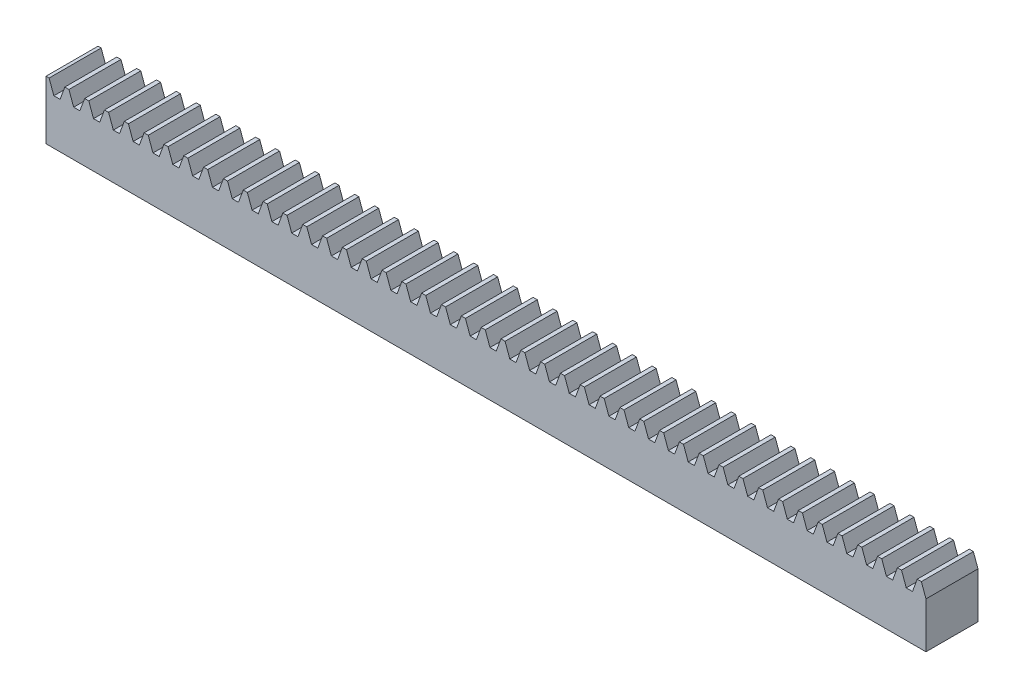
from build123d import *

# Parameters (mm, degrees)
SKETCH1_W           = 67.650000082
SKETCH1_H           = 4
BOSS_EXTRUDE1_DEPTH = 4.5
CUT_EXTRUDE1_DEPTH  = 68.917394761


with BuildPart() as part:
    # Sketch1 → Boss-Extrude1 (new body)
    with BuildSketch(Plane(origin=(0, 0, 0), x_dir=(1, 0, 0), z_dir=(0, 1, 0))):
        with Locations((33.825000041, 2)):
            Rectangle(SKETCH1_W, SKETCH1_H)
    extrude(amount=BOSS_EXTRUDE1_DEPTH)

    # Sketch2 → Cut-Extrude1 (cut, through all)
    with BuildSketch(Plane.XY):
        Polygon((0.239013956, 4.5), (0.60298419, 3.5), (0.841998146, 3.5), (1.081012101, 3.5), (1.444982335, 4.5), align=None)
        Polygon((1.763013956, 4.5), (2.12698419, 3.5), (2.365998146, 3.5), (2.605012101, 3.5), (2.968982335, 4.5), align=None)
        Polygon((3.287013956, 4.5), (3.65098419, 3.5), (3.889998146, 3.5), (4.129012101, 3.5), (4.492982335, 4.5), align=None)
        Polygon((4.811013956, 4.5), (5.17498419, 3.5), (5.413998146, 3.5), (5.653012101, 3.5), (6.016982335, 4.5), align=None)
        Polygon((6.335013956, 4.5), (6.69898419, 3.5), (6.937998146, 3.5), (7.177012101, 3.5), (7.540982335, 4.5), align=None)
        Polygon((7.859013956, 4.5), (8.22298419, 3.5), (8.461998146, 3.5), (8.701012101, 3.5), (9.064982335, 4.5), align=None)
        Polygon((9.383013956, 4.5), (9.74698419, 3.5), (9.985998146, 3.5), (10.225012101, 3.5), (10.588982335, 4.5), align=None)
        Polygon((10.907013956, 4.5), (11.27098419, 3.5), (11.509998146, 3.5), (11.749012101, 3.5), (12.112982335, 4.5), align=None)
        Polygon((12.431013956, 4.5), (12.79498419, 3.5), (13.033998146, 3.5), (13.273012101, 3.5), (13.636982335, 4.5), align=None)
        Polygon((13.955013956, 4.5), (14.31898419, 3.5), (14.557998146, 3.5), (14.797012101, 3.5), (15.160982335, 4.5), align=None)
        Polygon((15.479013956, 4.5), (15.84298419, 3.5), (16.081998146, 3.5), (16.321012101, 3.5), (16.684982335, 4.5), align=None)
        Polygon((17.003013956, 4.5), (17.36698419, 3.5), (17.605998146, 3.5), (17.845012101, 3.5), (18.208982335, 4.5), align=None)
        Polygon((18.527013956, 4.5), (18.89098419, 3.5), (19.129998146, 3.5), (19.369012101, 3.5), (19.732982335, 4.5), align=None)
        Polygon((20.051013956, 4.5), (20.41498419, 3.5), (20.653998146, 3.5), (20.893012101, 3.5), (21.256982335, 4.5), align=None)
        Polygon((21.575013956, 4.5), (21.93898419, 3.5), (22.177998146, 3.5), (22.417012101, 3.5), (22.780982335, 4.5), align=None)
        Polygon((23.099013956, 4.5), (23.46298419, 3.5), (23.701998146, 3.5), (23.941012101, 3.5), (24.304982335, 4.5), align=None)
        Polygon((24.623013956, 4.5), (24.98698419, 3.5), (25.225998146, 3.5), (25.465012101, 3.5), (25.828982335, 4.5), align=None)
        Polygon((26.147013956, 4.5), (26.51098419, 3.5), (26.749998146, 3.5), (26.989012101, 3.5), (27.352982335, 4.5), align=None)
        Polygon((27.671013956, 4.5), (28.03498419, 3.5), (28.273998146, 3.5), (28.513012101, 3.5), (28.876982335, 4.5), align=None)
        Polygon((29.195013956, 4.5), (29.55898419, 3.5), (29.797998146, 3.5), (30.037012101, 3.5), (30.400982335, 4.5), align=None)
        Polygon((30.719013956, 4.5), (31.08298419, 3.5), (31.321998146, 3.5), (31.561012101, 3.5), (31.924982335, 4.5), align=None)
        Polygon((32.243013956, 4.5), (32.60698419, 3.5), (32.845998146, 3.5), (33.085012101, 3.5), (33.448982335, 4.5), align=None)
        Polygon((33.767013956, 4.5), (34.13098419, 3.5), (34.369998146, 3.5), (34.609012101, 3.5), (34.972982335, 4.5), align=None)
        Polygon((35.291013956, 4.5), (35.65498419, 3.5), (35.893998146, 3.5), (36.133012101, 3.5), (36.496982335, 4.5), align=None)
        Polygon((36.815013956, 4.5), (37.17898419, 3.5), (37.417998146, 3.5), (37.657012101, 3.5), (38.020982335, 4.5), align=None)
        Polygon((38.339013956, 4.5), (38.70298419, 3.5), (38.941998146, 3.5), (39.181012101, 3.5), (39.544982335, 4.5), align=None)
        Polygon((39.863013956, 4.5), (40.22698419, 3.5), (40.465998146, 3.5), (40.705012101, 3.5), (41.068982335, 4.5), align=None)
        Polygon((41.387013956, 4.5), (41.75098419, 3.5), (41.989998146, 3.5), (42.229012101, 3.5), (42.592982335, 4.5), align=None)
        Polygon((42.911013956, 4.5), (43.27498419, 3.5), (43.513998146, 3.5), (43.753012101, 3.5), (44.116982335, 4.5), align=None)
        Polygon((44.435013956, 4.5), (44.79898419, 3.5), (45.037998146, 3.5), (45.277012101, 3.5), (45.640982335, 4.5), align=None)
        Polygon((45.959013956, 4.5), (46.32298419, 3.5), (46.561998146, 3.5), (46.801012101, 3.5), (47.164982335, 4.5), align=None)
        Polygon((47.483013956, 4.5), (47.84698419, 3.5), (48.085998146, 3.5), (48.325012101, 3.5), (48.688982335, 4.5), align=None)
        Polygon((49.007013956, 4.5), (49.37098419, 3.5), (49.609998146, 3.5), (49.849012101, 3.5), (50.212982335, 4.5), align=None)
        Polygon((50.531013956, 4.5), (50.89498419, 3.5), (51.133998146, 3.5), (51.373012101, 3.5), (51.736982335, 4.5), align=None)
        Polygon((52.055013956, 4.5), (52.41898419, 3.5), (52.657998146, 3.5), (52.897012101, 3.5), (53.260982335, 4.5), align=None)
        Polygon((53.579013956, 4.5), (53.94298419, 3.5), (54.181998146, 3.5), (54.421012101, 3.5), (54.784982335, 4.5), align=None)
        Polygon((55.103013956, 4.5), (55.46698419, 3.5), (55.705998146, 3.5), (55.945012101, 3.5), (56.308982335, 4.5), align=None)
        Polygon((56.627013956, 4.5), (56.99098419, 3.5), (57.229998146, 3.5), (57.469012101, 3.5), (57.832982335, 4.5), align=None)
        Polygon((58.151013956, 4.5), (58.51498419, 3.5), (58.753998146, 3.5), (58.993012101, 3.5), (59.356982335, 4.5), align=None)
        Polygon((59.675013956, 4.5), (60.03898419, 3.5), (60.277998146, 3.5), (60.517012101, 3.5), (60.880982335, 4.5), align=None)
        Polygon((61.199013956, 4.5), (61.56298419, 3.5), (61.801998146, 3.5), (62.041012101, 3.5), (62.404982335, 4.5), align=None)
        Polygon((62.723013956, 4.5), (63.08698419, 3.5), (63.325998146, 3.5), (63.565012101, 3.5), (63.928982335, 4.5), align=None)
        Polygon((64.247013956, 4.5), (64.61098419, 3.5), (64.849998146, 3.5), (65.089012101, 3.5), (65.452982335, 4.5), align=None)
        Polygon((65.771013956, 4.5), (66.13498419, 3.5), (66.373998146, 3.5), (66.613012101, 3.5), (66.976982335, 4.5), align=None)
        Polygon((67.295013956, 4.5), (67.65898419, 3.5), (67.897998146, 3.5), (68.137012101, 3.5), (68.500982335, 4.5), align=None)
        Polygon((68.819013956, 4.5), (69.18298419, 3.5), (69.421998146, 3.5), (69.661012101, 3.5), (70.024982335, 4.5), align=None)
        Polygon((70.343013956, 4.5), (70.70698419, 3.5), (70.945998146, 3.5), (71.185012101, 3.5), (71.548982335, 4.5), align=None)
        Polygon((71.867013956, 4.5), (72.23098419, 3.5), (72.469998146, 3.5), (72.709012101, 3.5), (73.072982335, 4.5), align=None)
        Polygon((73.391013956, 4.5), (73.75498419, 3.5), (73.993998146, 3.5), (74.233012101, 3.5), (74.596982335, 4.5), align=None)
        Polygon((74.915013956, 4.5), (75.27898419, 3.5), (75.517998146, 3.5), (75.757012101, 3.5), (76.120982335, 4.5), align=None)
        Polygon((76.439013956, 4.5), (76.80298419, 3.5), (77.041998146, 3.5), (77.281012101, 3.5), (77.644982335, 4.5), align=None)
        Polygon((77.963013956, 4.5), (78.32698419, 3.5), (78.565998146, 3.5), (78.805012101, 3.5), (79.168982335, 4.5), align=None)
        Polygon((79.487013956, 4.5), (79.85098419, 3.5), (80.089998146, 3.5), (80.329012101, 3.5), (80.692982335, 4.5), align=None)
        Polygon((81.011013956, 4.5), (81.37498419, 3.5), (81.613998146, 3.5), (81.853012101, 3.5), (82.216982335, 4.5), align=None)
        Polygon((82.535013956, 4.5), (82.89898419, 3.5), (83.137998146, 3.5), (83.377012101, 3.5), (83.740982335, 4.5), align=None)
        Polygon((84.059013956, 4.5), (84.42298419, 3.5), (84.661998146, 3.5), (84.901012101, 3.5), (85.264982335, 4.5), align=None)
        Polygon((85.583013956, 4.5), (85.94698419, 3.5), (86.185998146, 3.5), (86.425012101, 3.5), (86.788982335, 4.5), align=None)
        Polygon((87.107013956, 4.5), (87.47098419, 3.5), (87.709998146, 3.5), (87.949012101, 3.5), (88.312982335, 4.5), align=None)
        Polygon((88.631013956, 4.5), (88.99498419, 3.5), (89.233998146, 3.5), (89.473012101, 3.5), (89.836982335, 4.5), align=None)
        Polygon((90.155013956, 4.5), (90.51898419, 3.5), (90.757998146, 3.5), (90.997012101, 3.5), (91.360982335, 4.5), align=None)
        Polygon((91.679013956, 4.5), (92.04298419, 3.5), (92.281998146, 3.5), (92.521012101, 3.5), (92.884982335, 4.5), align=None)
        Polygon((93.203013956, 4.5), (93.56698419, 3.5), (93.805998146, 3.5), (94.045012101, 3.5), (94.408982335, 4.5), align=None)
        Polygon((94.727013956, 4.5), (95.09098419, 3.5), (95.329998146, 3.5), (95.569012101, 3.5), (95.932982335, 4.5), align=None)
        Polygon((96.251013956, 4.5), (96.61498419, 3.5), (96.853998146, 3.5), (97.093012101, 3.5), (97.456982335, 4.5), align=None)
        Polygon((97.775013956, 4.5), (98.13898419, 3.5), (98.377998146, 3.5), (98.617012101, 3.5), (98.980982335, 4.5), align=None)
        Polygon((99.299013956, 4.5), (99.66298419, 3.5), (99.901998146, 3.5), (100.141012101, 3.5), (100.504982335, 4.5), align=None)
        Polygon((100.823013956, 4.5), (101.18698419, 3.5), (101.425998146, 3.5), (101.665012101, 3.5), (102.028982335, 4.5), align=None)
        Polygon((102.347013956, 4.5), (102.71098419, 3.5), (102.949998146, 3.5), (103.189012101, 3.5), (103.552982335, 4.5), align=None)
        Polygon((103.871013956, 4.5), (104.23498419, 3.5), (104.473998146, 3.5), (104.713012101, 3.5), (105.076982335, 4.5), align=None)
        Polygon((105.395013956, 4.5), (105.75898419, 3.5), (105.997998146, 3.5), (106.237012101, 3.5), (106.600982335, 4.5), align=None)
        Polygon((106.919013956, 4.5), (107.28298419, 3.5), (107.521998146, 3.5), (107.761012101, 3.5), (108.124982335, 4.5), align=None)
        Polygon((108.443013956, 4.5), (108.80698419, 3.5), (109.045998146, 3.5), (109.285012101, 3.5), (109.648982335, 4.5), align=None)
        Polygon((109.967013956, 4.5), (110.33098419, 3.5), (110.569998146, 3.5), (110.809012101, 3.5), (111.172982335, 4.5), align=None)
        Polygon((111.491013956, 4.5), (111.85498419, 3.5), (112.093998146, 3.5), (112.333012101, 3.5), (112.696982335, 4.5), align=None)
        Polygon((113.015013956, 4.5), (113.37898419, 3.5), (113.617998146, 3.5), (113.857012101, 3.5), (114.220982335, 4.5), align=None)
        Polygon((114.539013956, 4.5), (114.90298419, 3.5), (115.141998146, 3.5), (115.381012101, 3.5), (115.744982335, 4.5), align=None)
        Polygon((116.063013956, 4.5), (116.42698419, 3.5), (116.665998146, 3.5), (116.905012101, 3.5), (117.268982335, 4.5), align=None)
        Polygon((117.587013956, 4.5), (117.95098419, 3.5), (118.189998146, 3.5), (118.429012101, 3.5), (118.792982335, 4.5), align=None)
        Polygon((119.111013956, 4.5), (119.47498419, 3.5), (119.713998146, 3.5), (119.953012101, 3.5), (120.316982335, 4.5), align=None)
        Polygon((120.635013956, 4.5), (120.99898419, 3.5), (121.237998146, 3.5), (121.477012101, 3.5), (121.840982335, 4.5), align=None)
        Polygon((122.159013956, 4.5), (122.52298419, 3.5), (122.761998146, 3.5), (123.001012101, 3.5), (123.364982335, 4.5), align=None)
        Polygon((123.683013956, 4.5), (124.04698419, 3.5), (124.285998146, 3.5), (124.525012101, 3.5), (124.888982335, 4.5), align=None)
        Polygon((125.207013956, 4.5), (125.57098419, 3.5), (125.809998146, 3.5), (126.049012101, 3.5), (126.412982335, 4.5), align=None)
        Polygon((126.731013956, 4.5), (127.09498419, 3.5), (127.333998146, 3.5), (127.573012101, 3.5), (127.936982335, 4.5), align=None)
        Polygon((128.255013956, 4.5), (128.61898419, 3.5), (128.857998146, 3.5), (129.097012101, 3.5), (129.460982335, 4.5), align=None)
        Polygon((129.779013956, 4.5), (130.14298419, 3.5), (130.381998146, 3.5), (130.621012101, 3.5), (130.984982335, 4.5), align=None)
        Polygon((131.303013956, 4.5), (131.66698419, 3.5), (131.905998146, 3.5), (132.145012101, 3.5), (132.508982335, 4.5), align=None)
        Polygon((132.827013956, 4.5), (133.19098419, 3.5), (133.429998146, 3.5), (133.669012101, 3.5), (134.032982335, 4.5), align=None)
        Polygon((134.351013956, 4.5), (134.71498419, 3.5), (134.953998146, 3.5), (135.193012101, 3.5), (135.556982335, 4.5), align=None)
        Polygon((135.875013956, 4.5), (136.23898419, 3.5), (136.477998146, 3.5), (136.717012101, 3.5), (137.080982335, 4.5), align=None)
        Polygon((137.399013956, 4.5), (137.76298419, 3.5), (138.001998146, 3.5), (138.241012101, 3.5), (138.604982335, 4.5), align=None)
        Polygon((138.923013956, 4.5), (139.28698419, 3.5), (139.525998146, 3.5), (139.765012101, 3.5), (140.128982335, 4.5), align=None)
        Polygon((140.447013956, 4.5), (140.81098419, 3.5), (141.049998146, 3.5), (141.289012101, 3.5), (141.652982335, 4.5), align=None)
        Polygon((141.971013956, 4.5), (142.33498419, 3.5), (142.573998146, 3.5), (142.813012101, 3.5), (143.176982335, 4.5), align=None)
        Polygon((143.495013956, 4.5), (143.85898419, 3.5), (144.097998146, 3.5), (144.337012101, 3.5), (144.700982335, 4.5), align=None)
        Polygon((145.019013956, 4.5), (145.38298419, 3.5), (145.621998146, 3.5), (145.861012101, 3.5), (146.224982335, 4.5), align=None)
        Polygon((146.543013956, 4.5), (146.90698419, 3.5), (147.145998146, 3.5), (147.385012101, 3.5), (147.748982335, 4.5), align=None)
        Polygon((148.067013956, 4.5), (148.43098419, 3.5), (148.669998146, 3.5), (148.909012101, 3.5), (149.272982335, 4.5), align=None)
        Polygon((149.591013956, 4.5), (149.95498419, 3.5), (150.193998146, 3.5), (150.433012101, 3.5), (150.796982335, 4.5), align=None)
        Polygon((151.115013956, 4.5), (151.47898419, 3.5), (151.717998146, 3.5), (151.957012101, 3.5), (152.320982335, 4.5), align=None)
        Polygon((152.639013956, 4.5), (153.00298419, 3.5), (153.241998146, 3.5), (153.481012101, 3.5), (153.844982335, 4.5), align=None)
        Polygon((154.163013956, 4.5), (154.52698419, 3.5), (154.765998146, 3.5), (155.005012101, 3.5), (155.368982335, 4.5), align=None)
        Polygon((155.687013956, 4.5), (156.05098419, 3.5), (156.289998146, 3.5), (156.529012101, 3.5), (156.892982335, 4.5), align=None)
        Polygon((157.211013956, 4.5), (157.57498419, 3.5), (157.813998146, 3.5), (158.053012101, 3.5), (158.416982335, 4.5), align=None)
        Polygon((158.735013956, 4.5), (159.09898419, 3.5), (159.337998146, 3.5), (159.577012101, 3.5), (159.940982335, 4.5), align=None)
        Polygon((160.259013956, 4.5), (160.62298419, 3.5), (160.861998146, 3.5), (161.101012101, 3.5), (161.464982335, 4.5), align=None)
        Polygon((161.783013956, 4.5), (162.14698419, 3.5), (162.385998146, 3.5), (162.625012101, 3.5), (162.988982335, 4.5), align=None)
        Polygon((163.307013956, 4.5), (163.67098419, 3.5), (163.909998146, 3.5), (164.149012101, 3.5), (164.512982335, 4.5), align=None)
        Polygon((164.831013956, 4.5), (165.19498419, 3.5), (165.433998146, 3.5), (165.673012101, 3.5), (166.036982335, 4.5), align=None)
        Polygon((166.355013956, 4.5), (166.71898419, 3.5), (166.957998146, 3.5), (167.197012101, 3.5), (167.560982335, 4.5), align=None)
        Polygon((167.879013956, 4.5), (168.24298419, 3.5), (168.481998146, 3.5), (168.721012101, 3.5), (169.084982335, 4.5), align=None)
        Polygon((169.403013956, 4.5), (169.76698419, 3.5), (170.005998146, 3.5), (170.245012101, 3.5), (170.608982335, 4.5), align=None)
        Polygon((170.927013956, 4.5), (171.29098419, 3.5), (171.529998146, 3.5), (171.769012101, 3.5), (172.132982335, 4.5), align=None)
        Polygon((172.451013956, 4.5), (172.81498419, 3.5), (173.053998146, 3.5), (173.293012101, 3.5), (173.656982335, 4.5), align=None)
        Polygon((173.975013956, 4.5), (174.33898419, 3.5), (174.577998146, 3.5), (174.817012101, 3.5), (175.180982335, 4.5), align=None)
        Polygon((175.499013956, 4.5), (175.86298419, 3.5), (176.101998146, 3.5), (176.341012101, 3.5), (176.704982335, 4.5), align=None)
        Polygon((177.023013956, 4.5), (177.38698419, 3.5), (177.625998146, 3.5), (177.865012101, 3.5), (178.228982335, 4.5), align=None)
        Polygon((178.547013956, 4.5), (178.91098419, 3.5), (179.149998146, 3.5), (179.389012101, 3.5), (179.752982335, 4.5), align=None)
        Polygon((180.071013956, 4.5), (180.43498419, 3.5), (180.673998146, 3.5), (180.913012101, 3.5), (181.276982335, 4.5), align=None)
        Polygon((181.595013956, 4.5), (181.95898419, 3.5), (182.197998146, 3.5), (182.437012101, 3.5), (182.800982335, 4.5), align=None)
        Polygon((183.119013956, 4.5), (183.48298419, 3.5), (183.721998146, 3.5), (183.961012101, 3.5), (184.324982335, 4.5), align=None)
        Polygon((184.643013956, 4.5), (185.00698419, 3.5), (185.245998146, 3.5), (185.485012101, 3.5), (185.848982335, 4.5), align=None)
        Polygon((186.167013956, 4.5), (186.53098419, 3.5), (186.769998146, 3.5), (187.009012101, 3.5), (187.372982335, 4.5), align=None)
        Polygon((187.691013956, 4.5), (188.05498419, 3.5), (188.293998146, 3.5), (188.533012101, 3.5), (188.896982335, 4.5), align=None)
        Polygon((189.215013956, 4.5), (189.57898419, 3.5), (189.817998146, 3.5), (190.057012101, 3.5), (190.420982335, 4.5), align=None)
    extrude(amount=-CUT_EXTRUDE1_DEPTH, mode=Mode.SUBTRACT)


solid = part.part
